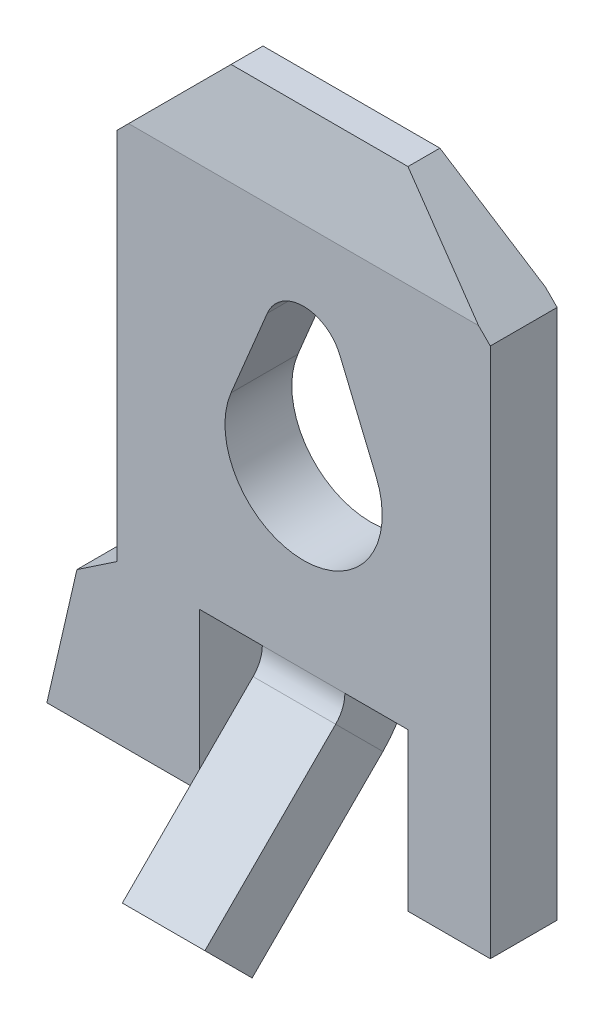
from build123d import *

# Parameters (mm, degrees)
BOSS_EXTRUDE1_DEPTH    = 4.75
CUT_EXTRUDE1_REACH     = 11.471
CUT_EXTRUDE2_DEPTH     = 0.85
SKETCH6_W              = 0.8
SKETCH6_H              = 2
CUT_EXTRUDE3_DEPTH     = 0.85
SKETCH7_W              = 1.05
SKETCH7_H              = 0.85
BOSS_EXTRUDE2_DEPTH    = 1
SKETCHED_START         = 1.85
SKETCHED_BEND1_DEPTH   = 1.05
SKETCHED_BEND1_2_DEPTH = 1.05
BOSS_EXTRUDE3_DEPTH    = 0.85


# Read off the part's stored shape, not the designer's step: Sketched Bend1
with BuildPart() as part:
    # Sketch1 → Boss-Extrude1 (new body)
    with BuildSketch(Plane(origin=(0, 0, 0), x_dir=(0, 0, -1), z_dir=(1, 0, 0))):
        Polygon((0, 0.15), (0, 7.05), (-0.241393443, 8.15), (-0.647131148, 8.15), (-0.85, 7.05), (-0.85, 0.15), align=None)
    extrude(amount=BOSS_EXTRUDE1_DEPTH)

    # Cut-Extrude1: up to this face of the body (flat: up to its plane)
    cut_extrude1_end = Plane(part.part.faces().sort_by_distance((2.375, 3.6, 0))[0])
    # Sketch4 → Cut-Extrude1 (cut, up to the picked face)
    with BuildSketch(Plane.XY.offset(0.85), mode=Mode.PRIVATE) as cut_extrude1_sk1:
        Polygon((0, 6.9), (1.25, 8.15), (0, 8.15), align=None)
    cut_extrude1_tool1 = split(extrude(cut_extrude1_sk1.sketch, amount=-CUT_EXTRUDE1_REACH, mode=Mode.PRIVATE), bisect_by=cut_extrude1_end, keep=Keep.BOTH, mode=Mode.PRIVATE)
    # Sketch4 → Cut-Extrude1 (cut, up to the picked face)
    with BuildSketch(Plane.XY.offset(0.85), mode=Mode.PRIVATE) as cut_extrude1_sk2:
        Polygon((3.5, 8.15), (4.75, 6.9), (4.75, 8.15), align=None)
    cut_extrude1_tool2 = split(extrude(cut_extrude1_sk2.sketch, amount=-CUT_EXTRUDE1_REACH, mode=Mode.PRIVATE), bisect_by=cut_extrude1_end, keep=Keep.BOTH, mode=Mode.PRIVATE)
    add(cut_extrude1_tool1.solids().sort_by(Axis((0.416667, 7.733333, 0.85), (0, 0, -1)))[0], mode=Mode.SUBTRACT)
    add(cut_extrude1_tool2.solids().sort_by(Axis((4.333333, 7.733333, 0.85), (0, 0, -1)))[0], mode=Mode.SUBTRACT)

    # Sketch5 → Cut-Extrude2 (cut)
    with BuildSketch(Plane.XY.offset(0.85)):
        with BuildLine():
            Line((1.913461538, 5.842307692), (1.451923077, 4.734615385))
            ThreePointArc((1.451923077, 4.734615385), (2.37510742, 3.350000006), (3.297994271, 4.734813689))
            Line((3.297994271, 4.734813689), (2.842436975, 5.827489929))
            ThreePointArc((2.842436975, 5.827489929), (2.382974312, 6.149936406), (1.913461538, 5.842307692))
        make_face()
    extrude(amount=-CUT_EXTRUDE2_DEPTH, mode=Mode.SUBTRACT)

    # Sketch6 → Cut-Extrude3 (cut)
    with BuildSketch(Plane(origin=(0, 0, 0), x_dir=(-1, 0, 0), z_dir=(0, 0, -1))):
        with Locations((-3.3, 1.15)):
            Rectangle(SKETCH6_W, SKETCH6_H)
        with Locations((-1.45, 1.15)):
            Rectangle(SKETCH6_W, SKETCH6_H)
    extrude(amount=-CUT_EXTRUDE3_DEPTH, mode=Mode.SUBTRACT)

    # Sketch7 → Boss-Extrude2 (add)
    with BuildSketch(Plane.XZ.offset(-0.15)):
        with Locations((2.375, 0.425)):
            Rectangle(SKETCH7_W, SKETCH7_H)
    extrude(amount=BOSS_EXTRUDE2_DEPTH)

    # Sketched Bend1 outline → Sketched Bend1 (cut)
    with BuildSketch(Plane.YZ.offset(SKETCHED_START)):
        with BuildLine():
            Line((1.266116524, 0.366116524), (0.782233048, 0.85))
            Line((0.782233048, 0.85), (-0.85, 0.85))
            Line((-0.85, 0.85), (-0.85, 0))
            Line((-0.85, 0), (2.15, 0))
            ThreePointArc((2.15, 0), (1.67164571, 0.095150584), (1.266116524, 0.366116524))
        make_face()
    extrude(amount=SKETCHED_BEND1_DEPTH, mode=Mode.SUBTRACT)

    # Sketched Bend1 2 outline → Sketched Bend1 2 (add)
    with BuildSketch(Plane.YZ.offset(SKETCHED_START)):
        with BuildLine():
            ThreePointArc((2.15, 0.85), (1.996926627, 0.880448187), (1.867157288, 0.967157288))
            Line((1.867157288, 0.967157288), (0.204009247, 2.630305328))
            Line((0.204009247, 2.630305328), (-0.397031517, 2.029264564))
            Line((-0.397031517, 2.029264564), (0.782233048, 0.85))
            Line((0.782233048, 0.85), (2.15, 0.85))
        make_face()
    extrude(amount=SKETCHED_BEND1_2_DEPTH)

    # Sketch15 → Boss-Extrude3 (add)
    with BuildSketch(Plane.XY.offset(0.85)):
        Polygon((0, 2.15), (-0.50789834, 1.808617859), (-0.890356386, 0.15), (0, 0.15), align=None)
    extrude(amount=-BOSS_EXTRUDE3_DEPTH)


solid = part.part
